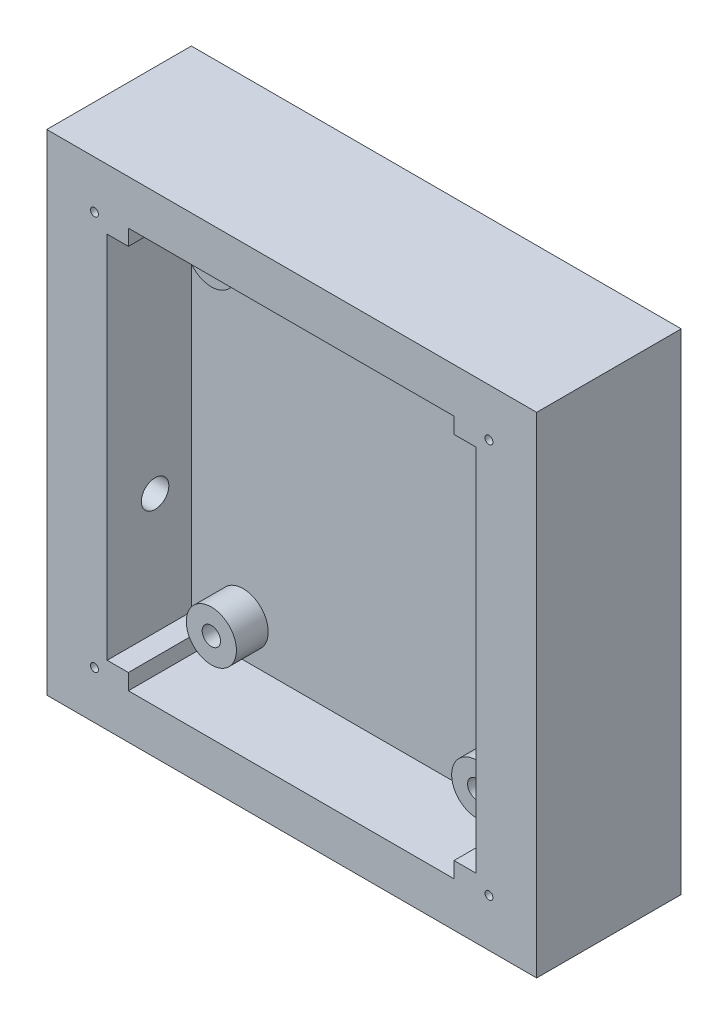
from build123d import *

# Parameters (mm, degrees)
ESQUISSE1_W             = 0.308
ESQUISSE1_H             = 0.308
BOSS_EXTRU_1_DEPTH      = 0.0909
COQUE1_T                = -0.038
ESQUISSE2_R             = 0.0025
ENL_V_MAT_EXTRU_1_DEPTH = 0.04
ESQUISSE4_W             = 0.204749243
ESQUISSE4_H             = 0.009950292
ENL_V_MAT_EXTRU_2_DEPTH = 0.0529
ESQUISSE3_R             = 0.01577
BOSS_EXTRU_2_DEPTH      = 0.02
ESQUISSE3_4_R           = 0.00577
ENL_V_MAT_EXTRU_3_DEPTH = 0.02
ESQUISSE6_R             = 0.008629602
ENL_V_MAT_EXTRU_4_DEPTH = 0.05


with BuildPart() as part:
    # Esquisse1 → Boss.-Extru.1 (new body)
    with BuildSketch(Plane.XY):
        Rectangle(ESQUISSE1_W, ESQUISSE1_H)
    extrude(amount=BOSS_EXTRU_1_DEPTH)

    # Coque1
    coque1_openings = [part.faces().sort_by_distance(p)[0] for p in [
        (0, 0, 0.0909),
    ]]
    offset(amount=COQUE1_T, openings=coque1_openings, kind=Kind.INTERSECTION)

    # Esquisse2 → Enlèv. mat.-Extru.1 (cut)
    with BuildSketch(Plane.XY.offset(0.0909)):
        with Locations((-0.124, 0.124)):
            Circle(ESQUISSE2_R)
        with Locations((0.124, -0.124)):
            Circle(ESQUISSE2_R)
        with Locations((0.124, 0.124)):
            Circle(ESQUISSE2_R)
        with Locations((-0.124, -0.124)):
            Circle(ESQUISSE2_R)
    extrude(amount=-ENL_V_MAT_EXTRU_1_DEPTH, mode=Mode.SUBTRACT)

    # Esquisse4 → Enlèv. mat.-Extru.2 (cut)
    with BuildSketch(Plane.XY.offset(0.0909)):
        with Locations((-0.000312916, 0.120975146)):
            Rectangle(ESQUISSE4_W, ESQUISSE4_H)
        with Locations((-0.000312916, -0.120975146)):
            Rectangle(ESQUISSE4_W, ESQUISSE4_H)
    extrude(amount=-ENL_V_MAT_EXTRU_2_DEPTH, mode=Mode.SUBTRACT)

    # Esquisse3 → Boss.-Extru.2 (add)
    with BuildSketch(Plane.XY.offset(0.038)):
        with Locations((-0.08342, 0.10292)):
            Circle(ESQUISSE3_R)
        with Locations((-0.08342, -0.10292)):
            Circle(ESQUISSE3_R)
        with Locations((0.08342, -0.10292)):
            Circle(ESQUISSE3_R)
        with Locations((0.08342, 0.10292)):
            Circle(ESQUISSE3_R)
    extrude(amount=BOSS_EXTRU_2_DEPTH)

    # Esquisse3<4> → Enlèv. mat.-Extru.3 (cut)
    with BuildSketch(Plane.XY.offset(0.038)):
        with Locations((-0.08342, 0.10292)):
            Circle(ESQUISSE3_4_R)
        with Locations((-0.08342, -0.10292)):
            Circle(ESQUISSE3_4_R)
        with Locations((0.08342, -0.10292)):
            Circle(ESQUISSE3_4_R)
        with Locations((0.08342, 0.10292)):
            Circle(ESQUISSE3_4_R)
    extrude(amount=ENL_V_MAT_EXTRU_3_DEPTH, mode=Mode.SUBTRACT)

    # Esquisse6 → Enlèv. mat.-Extru.4 (cut)
    with BuildSketch(Plane.ZY.offset(0.154)):
        with Locations((0.060790501, -0.040287358)):
            Circle(ESQUISSE6_R)
    extrude(amount=-ENL_V_MAT_EXTRU_4_DEPTH, mode=Mode.SUBTRACT)


solid = part.part
